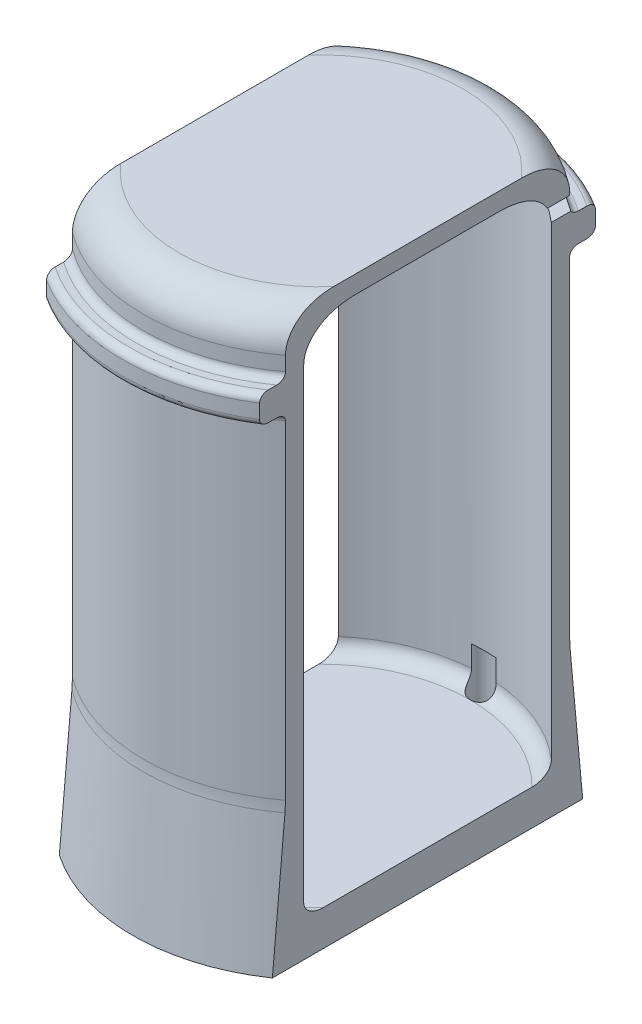
from build123d import *

# Parameters (mm, degrees)
FILLET1_R               = 5
FILLET2_R               = 1
SKETCH4_OUTSIDE_W       = 80.514
SKETCH4_OUTSIDE_H       = 80.514
SKETCH4_OUTSIDE_W_2     = 30
SKETCH4_OUTSIDE_H_2     = 56
CUT_EXTRUDE1_DEPTH      = 90.263654418
FILLET5_R               = 2
SKETCH8_R               = 1.75
CUT_EXTRUDE2_DEPTH      = 10
CUT_EXTRUDE3_DEPTH      = 87.075548355
CUT_EXTRUDE3_DEPTH_BACK = 87.075548355
SKETCH9_W               = 8.252682355
SKETCH9_H               = 2
FILLET6_R               = 20


with BuildPart() as part:
    # Sketch3 → Revolve1 (revolve)
    with BuildSketch(Plane.XY, mode=Mode.PRIVATE) as revolve1_sk:
        Polygon((25, 68), (28, 68), (28, 72), (25, 72), (25, 80), (0, 80), (0, 0), (25, 0), align=None)
    revolve(revolve1_sk.sketch.rotate(Axis((0, 0, 0), (0, 1, 0)), 90), axis=Axis((0, 0, 0), (0, 1, 0)))

    # Fillet1
    fillet1_edges = [part.edges().sort_by_distance(p)[0] for p in [
        (0, 80, 25),
    ]]
    fillet(fillet1_edges, radius=FILLET1_R)

    # Fillet2
    fillet2_edges = [part.edges().sort_by_distance(p)[0] for p in [
        (0, 68, 25),
        (0, 68, 28),
        (0, 72, 28),
        (0, 72, 25),
    ]]
    fillet(fillet2_edges, radius=FILLET2_R)

    # Sketch11 → Revolve2 (revolve)
    with BuildSketch(Plane(origin=(0, 0, 0), x_dir=(0, 0, -1), z_dir=(1, 0, 0))):
        Polygon((-25, 0), (-26.5, 0), (-25, 20), align=None)
    revolve(axis=Axis((0, 0, 0), (0, 1, 0)))

    # Sketch4 outside → Cut-Extrude1 (cut, through all)
    with BuildSketch(Plane(origin=(0, 0, 0), x_dir=(1, 0, 0), z_dir=(0, 1, 0))):
        Rectangle(SKETCH4_OUTSIDE_W, SKETCH4_OUTSIDE_H)
        Rectangle(SKETCH4_OUTSIDE_W_2, SKETCH4_OUTSIDE_H_2, mode=Mode.SUBTRACT)
    extrude(amount=CUT_EXTRUDE1_DEPTH, mode=Mode.SUBTRACT)

    # Sketch7 → Cut-Revolve2 (revolve, cut)
    with BuildSketch(Plane(origin=(0, 0, 0), x_dir=(0, 0, -1), z_dir=(1, 0, 0))):
        with BuildLine():
            Line((0, 77.5), (18, 77.5))
            ThreePointArc((18, 77.5), (21.535533906, 76.035533906), (23, 72.5))
            Line((23, 72.5), (23, 5))
            Line((23, 5), (0, 5))
            Line((0, 5), (0, 77.5))
        make_face()
    revolve(axis=Axis((0, 0, 0), (0, 1, 0)), mode=Mode.SUBTRACT)

    # Fillet5
    fillet5_edges = [part.edges().sort_by_distance(p)[0] for p in [
        (0, 5, -23),
        (0, 5, 23),
    ]]
    fillet(fillet5_edges, radius=FILLET5_R)

    # Sketch8 → Cut-Extrude2 (cut)
    with BuildSketch(Plane.XZ):
        with Locations(Location((0, 22.75, 0), (0, 0, 270))):
            Circle(SKETCH8_R)
        with Locations(Location((0, -22.75, 0), (0, 0, 90))):
            Circle(SKETCH8_R)
    extrude(amount=-CUT_EXTRUDE2_DEPTH, mode=Mode.SUBTRACT)

    # Sketch9 → Cut-Extrude3 (cut, two sides: drawn at the far end of the back side and taken through both)
    with BuildSketch(Plane(origin=(0, 0, 0), x_dir=(0, 0, -1), z_dir=(1, 0, 0)).offset(-CUT_EXTRUDE3_DEPTH_BACK)):
        with Locations((21.007633418, 73.5)):
            Rectangle(SKETCH9_W, SKETCH9_H)
    extrude(amount=CUT_EXTRUDE3_DEPTH + CUT_EXTRUDE3_DEPTH_BACK, mode=Mode.SUBTRACT)

    # Fillet6
    # the kernel refuses this fillet: 20 mm, written as the material it adds along each edge
    with BuildSketch(Plane(origin=(0, 20, 0), x_dir=(0.6581930832327514, 0, 0.7528491649623876), z_dir=(0.7528491649623876, 0, -0.6581930832327514))) as fillet6_piece_1_section:
        with BuildLine():
            CenterArc((25 + FILLET6_R, -FILLET6_R * 0.0374474134211), FILLET6_R, 175.710846671, 4.289153329)
            Line((25 + FILLET6_R * 0.00280069011154, FILLET6_R * 0.0373425348206), (25, 0))
            Line((25, 0), (25, -FILLET6_R * 0.0374474134211))
        make_face()
    fillet6_piece_1 = revolve(axis=Axis((0, 20, 0), (0, -1, 0)), revolution_arc=82.324424425, mode=Mode.PRIVATE)
    fillet6_piece_1 = split(fillet6_piece_1, bisect_by=Plane(origin=(15, 19.999513566, 24.987010206), z_dir=(-1, 0, 0)), keep=Keep.TOP, mode=Mode.PRIVATE)
    fillet6_piece_1 = split(fillet6_piece_1, bisect_by=Plane(origin=(-15, 19.999513566, 24.987010206), z_dir=(1, 0, 0)), keep=Keep.TOP, mode=Mode.PRIVATE)
    add(fillet6_piece_1)
    with BuildSketch(Plane(origin=(0, 20, 0), x_dir=(0.6581930832327513, 0, -0.7528491649623876), z_dir=(0.7528491649623876, 0, 0.6581930832327513))) as fillet6_piece_2_section:
        with BuildLine():
            CenterArc((25 + FILLET6_R, FILLET6_R * 0.0374474134211), FILLET6_R, 180, 4.289153329)
            Line((25, FILLET6_R * 0.0374474134211), (25, 0))
            Line((25, 0), (25 + FILLET6_R * 0.00280069011154, -FILLET6_R * 0.0373425348206))
        make_face()
    fillet6_piece_2 = revolve(axis=Axis((0, 20, 0), (0, 1, 0)), revolution_arc=82.324424425, mode=Mode.PRIVATE)
    fillet6_piece_2 = split(fillet6_piece_2, bisect_by=Plane(origin=(15, 19.999513566, -24.987010206), z_dir=(-1, 0, 0)), keep=Keep.TOP, mode=Mode.PRIVATE)
    fillet6_piece_2 = split(fillet6_piece_2, bisect_by=Plane(origin=(-15, 19.999513566, -24.987010206), z_dir=(1, 0, 0)), keep=Keep.TOP, mode=Mode.PRIVATE)
    add(fillet6_piece_2)


solid = part.part
